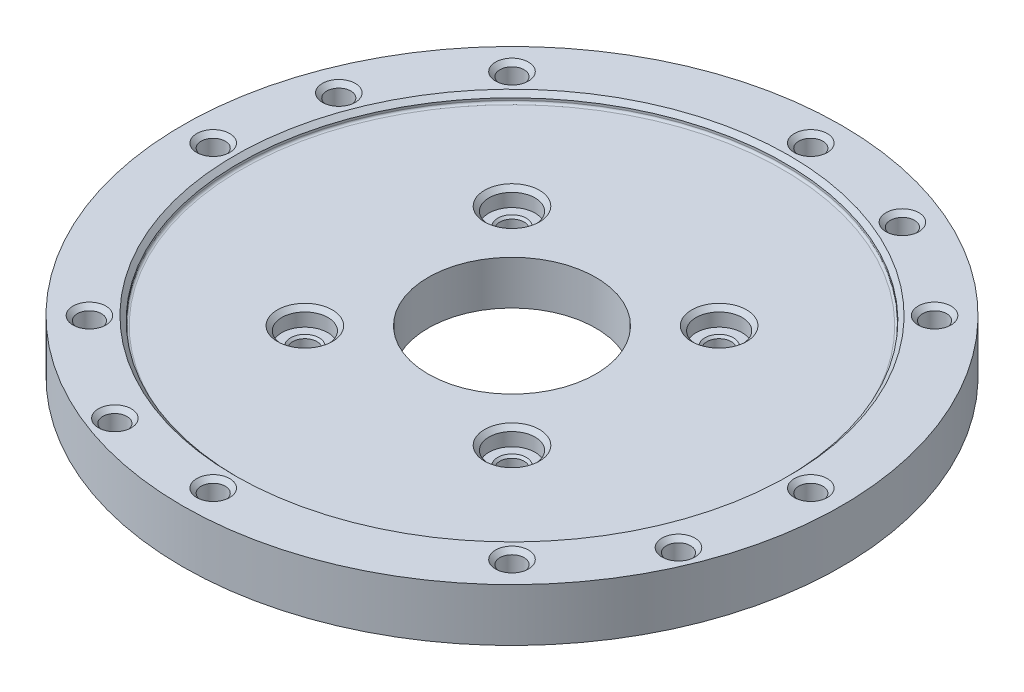
from build123d import *

# Parameters (mm, degrees)
SKETCH1_R           = 75
SKETCH1_R_2         = 19.075
BOSS_EXTRUDE1_DEPTH = 12
SKETCH2_R           = 2.75
CUT_EXTRUDE1_DEPTH  = 107.742681248
SKETCH3_R           = 5.25
CUT_EXTRUDE2_DEPTH  = 6
SKETCH4_R           = 62.1
CUT_EXTRUDE3_DEPTH  = 2
SKETCH5_R           = 2.75
CUT_EXTRUDE4_DEPTH  = 107.742681248
SKETCH8_R           = 5.5
CUT_EXTRUDE5_DEPTH  = 5
FILLET1_R           = 0.5
CHAMFER1_SIZE       = 1
CHAMFER2_SIZE       = 1
CHAMFER3_SIZE       = 1
CHAMFER4_SIZE       = 0.5


with BuildPart() as part:
    # Sketch1 → Boss-Extrude1 (new body)
    with BuildSketch(Plane(origin=(0, 0, 0), x_dir=(1, 0, 0), z_dir=(0, 1, 0))):
        Circle(SKETCH1_R)
        Circle(SKETCH1_R_2, mode=Mode.SUBTRACT)
    extrude(amount=BOSS_EXTRUDE1_DEPTH)

    # Sketch2 → Cut-Extrude1 (cut, through all)
    with BuildSketch(Plane(origin=(0, 12, 0), x_dir=(1, 0, 0), z_dir=(0, 1, 0))):
        with Locations((-23.57, 23.57)):
            Circle(SKETCH2_R)
        with Locations((23.57, 23.57)):
            Circle(SKETCH2_R)
        with Locations((-23.57, -23.57)):
            Circle(SKETCH2_R)
        with Locations((23.57, -23.57)):
            Circle(SKETCH2_R)
    extrude(amount=-CUT_EXTRUDE1_DEPTH, mode=Mode.SUBTRACT)

    # Sketch3 → Cut-Extrude2 (cut)
    with BuildSketch(Plane(origin=(0, 12, 0), x_dir=(1, 0, 0), z_dir=(0, 1, 0))):
        with Locations((-23.57, 23.57)):
            Circle(SKETCH3_R)
        with Locations((23.57, 23.57)):
            Circle(SKETCH3_R)
        with Locations((-23.57, -23.57)):
            Circle(SKETCH3_R)
        with Locations((23.57, -23.57)):
            Circle(SKETCH3_R)
    extrude(amount=-CUT_EXTRUDE2_DEPTH, mode=Mode.SUBTRACT)

    # Sketch4 → Cut-Extrude3 (cut)
    with BuildSketch(Plane(origin=(0, 12, 0), x_dir=(1, 0, 0), z_dir=(0, 1, 0))):
        Circle(SKETCH4_R)
    extrude(amount=-CUT_EXTRUDE3_DEPTH, mode=Mode.SUBTRACT)

    # Sketch5 → Cut-Extrude4 (cut, through all)
    with BuildSketch(Plane(origin=(0, 12, 0), x_dir=(1, 0, 0), z_dir=(0, 1, 0))):
        with Locations((0, 68)):
            Circle(SKETCH5_R)
        with Locations((48.083261121, 48.083261121)):
            Circle(SKETCH5_R)
        with Locations((68, 0)):
            Circle(SKETCH5_R)
        with Locations((48.083261121, -48.083261121)):
            Circle(SKETCH5_R)
        with Locations((0, -68)):
            Circle(SKETCH5_R)
        with Locations((-48.083261121, -48.083261121)):
            Circle(SKETCH5_R)
        with Locations((-68, 0)):
            Circle(SKETCH5_R)
        with Locations((-48.083261121, 48.083261121)):
            Circle(SKETCH5_R)
        with Locations((26.022473401, 62.823808211)):
            Circle(SKETCH5_R)
        with Locations((64.671567276, -26.787840266)):
            Circle(SKETCH5_R)
        with Locations((-24.940081201, -65.436934141)):
            Circle(SKETCH5_R)
        with Locations((-63.589175075, 24.174714336)):
            Circle(SKETCH5_R)
    extrude(amount=-CUT_EXTRUDE4_DEPTH, mode=Mode.SUBTRACT)

    # Sketch8 → Cut-Extrude5 (cut)
    with BuildSketch(Plane.XZ):
        with Locations((0, 68)):
            Circle(SKETCH8_R)
        with Locations((-48.083261121, 48.083261121)):
            Circle(SKETCH8_R)
        with Locations((48.083261121, 48.083261121)):
            Circle(SKETCH8_R)
        with Locations((48.083261121, -48.083261121)):
            Circle(SKETCH8_R)
        with Locations((0, -68)):
            Circle(SKETCH8_R)
        with Locations((-48.083261121, -48.083261121)):
            Circle(SKETCH8_R)
        with Locations((-68, 0)):
            Circle(SKETCH8_R)
        with Locations((68, 0)):
            Circle(SKETCH8_R)
    extrude(amount=-CUT_EXTRUDE5_DEPTH, mode=Mode.SUBTRACT)

    # Fillet1
    fillet1_edges = [part.edges().sort_by_distance(p)[0] for p in [
        (-62.1, 10, 0),
    ]]
    fillet(fillet1_edges, radius=FILLET1_R)

    # Chamfer1
    chamfer1_edges = [part.edges().sort_by_distance(p)[0] for p in [
        (-62.1, 12, 0),
    ]]
    chamfer(chamfer1_edges, length=CHAMFER1_SIZE)

    # Chamfer2
    chamfer2_edges = [part.edges().sort_by_distance(p)[0] for p in [
        (-2.75, 12, 68),
        (-70.75, 12, 0),
        (-50.833261121, 12, 48.083261121),
        (-27.690081201, 12, 65.436934141),
        (45.333261121, 12, 48.083261121),
        (61.921567276, 12, 26.787840266),
        (65.25, 12, 0),
        (45.333261121, 12, -48.083261121),
        (23.272473401, 12, -62.823808211),
        (-2.75, 12, -68),
        (-66.339175075, 12, -24.174714336),
        (-50.833261121, 12, -48.083261121),
        (-28.82, 10, -23.57),
        (18.32, 10, -23.57),
        (18.32, 10, 23.57),
        (-28.82, 10, 23.57),
    ]]
    chamfer(chamfer2_edges, length=CHAMFER2_SIZE)

    # Chamfer3
    chamfer3_edges = [part.edges().sort_by_distance(p)[0] for p in [
        (-5.5, 0, 68),
        (42.583261121, 0, 48.083261121),
        (62.5, 0, 0),
        (42.583261121, 0, -48.083261121),
        (-5.5, 0, -68),
        (-53.583261121, 0, -48.083261121),
        (-73.5, 0, 0),
        (-53.583261121, 0, 48.083261121),
    ]]
    chamfer(chamfer3_edges, length=CHAMFER3_SIZE)

    # Chamfer4
    chamfer4_edges = [part.edges().sort_by_distance(p)[0] for p in [
        (-26.32, 6, 23.57),
        (20.82, 6, 23.57),
        (20.82, 6, -23.57),
        (-26.32, 6, -23.57),
    ]]
    chamfer(chamfer4_edges, length=CHAMFER4_SIZE)


solid = part.part
